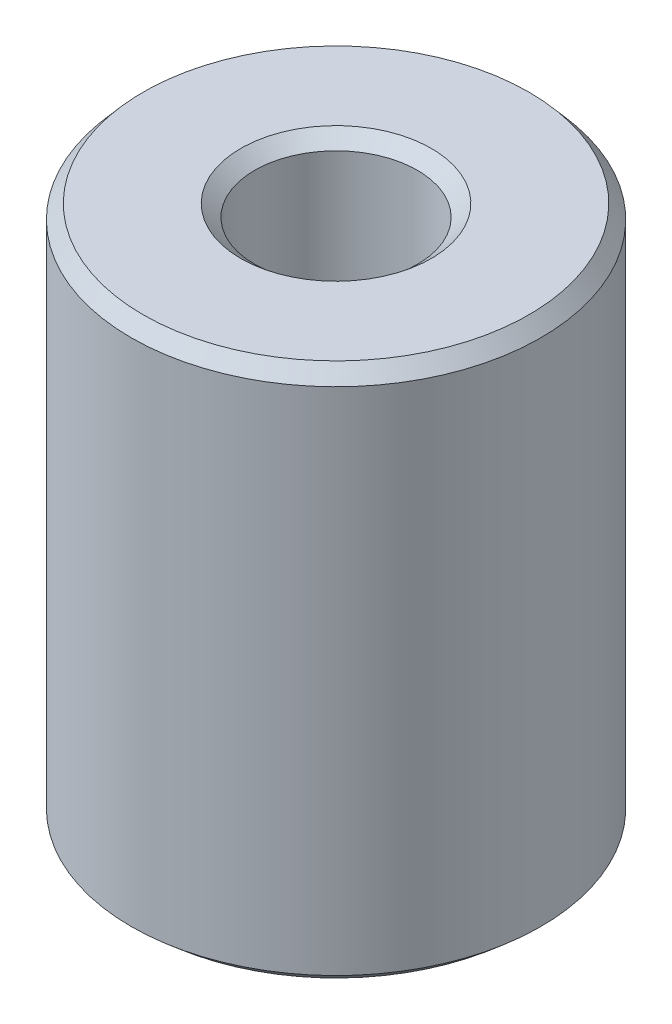
from build123d import *
from OCP.BRepFilletAPI import BRepFilletAPI_MakeChamfer

# Parameters (mm, degrees)
SKETCH1_R           = 27.5
BOSS_EXTRUDE1_DEPTH = 71.935032514
SKETCH2_R           = 10.930971704
CUT_EXTRUDE1_DEPTH  = 82.77498947
CHAMFER1_SIZE       = 1.869517118
CHAMFER1_SIZE2      = 1.606866891


with BuildPart() as part:
    # Sketch1 → Boss-Extrude1 (new body)
    with BuildSketch(Plane(origin=(0, 0, 0), x_dir=(1, 0, 0), z_dir=(0, 1, 0))):
        Circle(SKETCH1_R)
    extrude(amount=BOSS_EXTRUDE1_DEPTH)

    # Sketch2 → Cut-Extrude1 (cut, through all)
    with BuildSketch(Plane(origin=(0, 0, 0), x_dir=(1, 0, 0), z_dir=(0, 1, 0))):
        Circle(SKETCH2_R)
    extrude(amount=CUT_EXTRUDE1_DEPTH, mode=Mode.SUBTRACT)

    # Chamfer1: one chamfer whose edges measure the first distance from different faces: ONE call of the kernel's chamfer builder (chamfer() names one face for all edges)
    chamfer1_edges_1 = [part.edges().sort_by_distance(p)[0] for p in [
        (-10.930971704, 71.935032514, 0),
    ]]
    chamfer1_side_1 = [part.faces().sort_by_distance(p)[0] for p in [
        (-26.722182541, 71.935032514, 0),
    ]]
    chamfer1_edges_2 = [part.edges().sort_by_distance(p)[0] for p in [
        (-10.930971704, 0, 0),
    ]]
    chamfer1_side_2 = [part.faces().sort_by_distance(p)[0] for p in [
        (-10.930971704, 35.967516257, 0),
    ]]
    chamfer1_edges_3 = [part.edges().sort_by_distance(p)[0] for p in [
        (-27.5, 0, 0),
    ]]
    chamfer1_side_3 = [part.faces().sort_by_distance(p)[0] for p in [
        (-26.722182541, 0, 0),
    ]]
    chamfer1_edges_4 = [part.edges().sort_by_distance(p)[0] for p in [
        (-27.5, 71.935032514, 0),
    ]]
    chamfer1_side_4 = [part.faces().sort_by_distance(p)[0] for p in [
        (-27.5, 35.967516257, 0),
    ]]
    chamfer1 = BRepFilletAPI_MakeChamfer(part.part.solid().wrapped)
    for e in chamfer1_edges_1:
        chamfer1.Add(CHAMFER1_SIZE, CHAMFER1_SIZE2, e.wrapped, chamfer1_side_1[0].wrapped)  # the first distance lies on this face
    for e in chamfer1_edges_2:
        chamfer1.Add(CHAMFER1_SIZE, CHAMFER1_SIZE2, e.wrapped, chamfer1_side_2[0].wrapped)  # the first distance lies on this face
    for e in chamfer1_edges_3:
        chamfer1.Add(CHAMFER1_SIZE, CHAMFER1_SIZE2, e.wrapped, chamfer1_side_3[0].wrapped)  # the first distance lies on this face
    for e in chamfer1_edges_4:
        chamfer1.Add(CHAMFER1_SIZE, CHAMFER1_SIZE2, e.wrapped, chamfer1_side_4[0].wrapped)  # the first distance lies on this face
    add(Compound.cast(chamfer1.Shape()), mode=Mode.REPLACE)


solid = part.part
